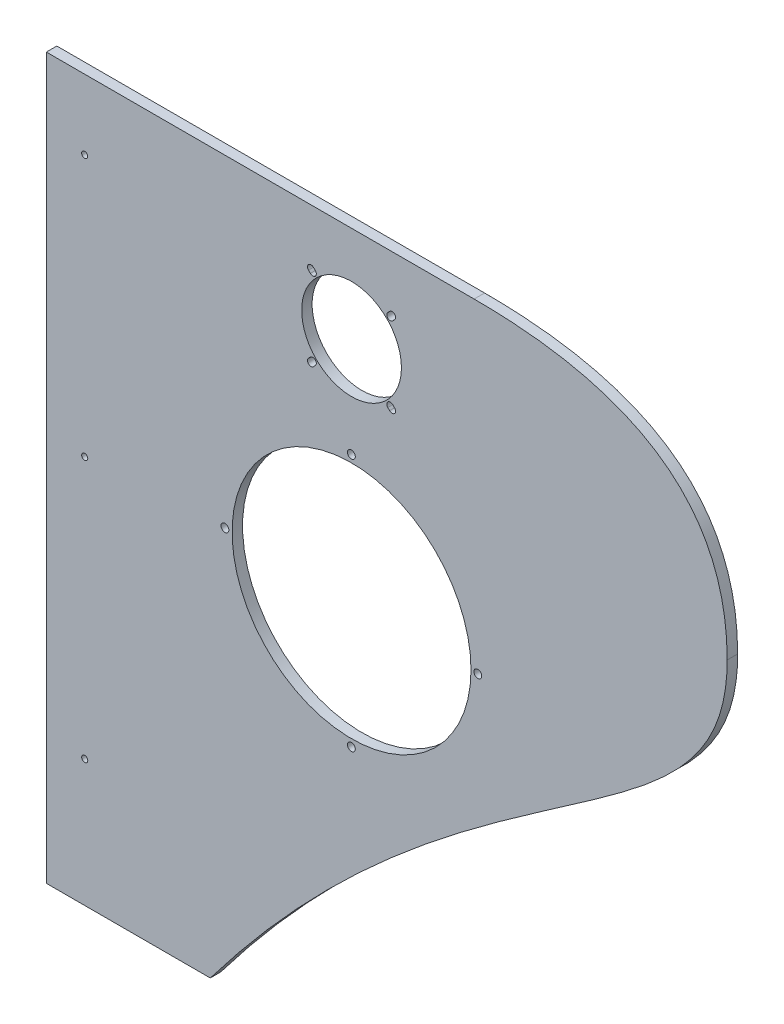
from build123d import *

# Parameters (mm, degrees)
BOSS_EXTRU_2_DEPTH      = 6
ENL_V_MAT_EXTRU_4_REACH = 384.756
ESQUISSE3_R             = 28.6
ESQUISSE3_R_2           = 2.25
ESQUISSE3_R_3           = 68.5
ESQUISSE3_R_4           = 1.75


# Read off the part's stored shape, not the designer's step: Boss.-Extru.2
with BuildPart() as part:
    # Boss.-Extru.2 outline → Boss.-Extru.2 (new body)
    with BuildSketch(Plane.XY):
        with BuildLine():
            Line((-245.29717671, -293.760797952), (-151.297176712, -293.760797952))
            add(Edge.make_bspline(
                [(-151.297176712, -293.760797952), (-0.19831868, -94.220513637), (145.094881688, -93.952973746), (145.094881688, 83.475896448), (96.728584845, 119.040016289), (-0.00400884, 119.040016289)],
                knots=[0, 0, 0, 0, 1, 1, 1.669123403, 1.669123403, 1.669123403, 1.669123403], degree=3))
            Line((-0.00400884, 119.040016289), (-245.29717671, 119.040016289))
            Line((-245.29717671, 119.040016289), (-245.29717671, -293.760797952))
        make_face()
    extrude(amount=BOSS_EXTRU_2_DEPTH)

    # Esquisse3 → Enlèv. mat.-Extru.4 (cut, up to next)
    with BuildSketch(Plane.XY.offset(6), mode=Mode.PRIVATE) as enl_v_mat_extru_4_sk1:
        with BuildLine():
            ThreePointArc((-45.626220991, 85.882544634), (-45.626220991, 88.710971759), (-48.454648116, 88.710971759))
            Line((-48.454648116, 88.710971759), (-49.515308288, 87.650311587))
            ThreePointArc((-49.515308288, 87.650311587), (-49.515308288, 84.821884462), (-46.686881163, 84.821884462))
            Line((-46.686881163, 84.821884462), (-45.626220991, 85.882544634))
        make_face()
    enl_v_mat_extru_4_tool1 = extrude(enl_v_mat_extru_4_sk1.sketch, amount=-ENL_V_MAT_EXTRU_4_REACH, mode=Mode.PRIVATE) & part.part
    # Esquisse3 → Enlèv. mat.-Extru.4 (cut, up to next)
    with BuildSketch(Plane.XY.offset(6), mode=Mode.PRIVATE) as enl_v_mat_extru_4_sk2:
        with BuildLine():
            ThreePointArc((-48.454648366, 39.369060568), (-45.626221242, 39.369060568), (-45.626221242, 42.197487693))
            Line((-45.626221242, 42.197487693), (-46.686881414, 43.258147865))
            ThreePointArc((-46.686881414, 43.258147865), (-49.515308538, 43.258147865), (-49.515308538, 40.42972074))
            Line((-49.515308538, 40.42972074), (-48.454648366, 39.369060568))
        make_face()
    enl_v_mat_extru_4_tool2 = extrude(enl_v_mat_extru_4_sk2.sketch, amount=-ENL_V_MAT_EXTRU_4_REACH, mode=Mode.PRIVATE) & part.part
    # Esquisse3 → Enlèv. mat.-Extru.4 (cut, up to next)
    with BuildSketch(Plane.XY.offset(6), mode=Mode.PRIVATE) as enl_v_mat_extru_4_sk3:
        with BuildLine():
            ThreePointArc((-94.968132433, 42.197487943), (-94.968132433, 39.369060819), (-92.139705308, 39.369060819))
            Line((-92.139705308, 39.369060819), (-91.079045136, 40.42972099))
            ThreePointArc((-91.079045136, 40.42972099), (-91.079045136, 43.258148115), (-93.907472261, 43.258148115))
            Line((-93.907472261, 43.258148115), (-94.968132433, 42.197487943))
        make_face()
    enl_v_mat_extru_4_tool3 = extrude(enl_v_mat_extru_4_sk3.sketch, amount=-ENL_V_MAT_EXTRU_4_REACH, mode=Mode.PRIVATE) & part.part
    # Esquisse3 → Enlèv. mat.-Extru.4 (cut, up to next)
    with BuildSketch(Plane.XY.offset(6), mode=Mode.PRIVATE) as enl_v_mat_extru_4_sk4:
        with BuildLine():
            ThreePointArc((-92.139705057, 88.710972009), (-94.968132182, 88.710972009), (-94.968132182, 85.882544885))
            Line((-94.968132182, 85.882544885), (-93.90747201, 84.821884713))
            ThreePointArc((-93.90747201, 84.821884713), (-91.079044886, 84.821884713), (-91.079044886, 87.650311838))
            Line((-91.079044886, 87.650311838), (-92.139705057, 88.710972009))
        make_face()
    enl_v_mat_extru_4_tool4 = extrude(enl_v_mat_extru_4_sk4.sketch, amount=-ENL_V_MAT_EXTRU_4_REACH, mode=Mode.PRIVATE) & part.part
    # Esquisse3 → Enlèv. mat.-Extru.4 (cut, up to next)
    with BuildSketch(Plane.XY.offset(6), mode=Mode.PRIVATE) as enl_v_mat_extru_4_sk5:
        with Locations((-70.29717671, 64.040016289)):
            Circle(ESQUISSE3_R)
    enl_v_mat_extru_4_tool5 = extrude(enl_v_mat_extru_4_sk5.sketch, amount=-ENL_V_MAT_EXTRU_4_REACH, mode=Mode.PRIVATE) & part.part
    # Esquisse3 → Enlèv. mat.-Extru.4 (cut, up to next)
    with BuildSketch(Plane.XY.offset(6), mode=Mode.PRIVATE) as enl_v_mat_extru_4_sk6:
        with Locations((-70.403386226, 6.6461892)):
            Circle(ESQUISSE3_R_2)
    enl_v_mat_extru_4_tool6 = extrude(enl_v_mat_extru_4_sk6.sketch, amount=-ENL_V_MAT_EXTRU_4_REACH, mode=Mode.PRIVATE) & part.part
    # Esquisse3 → Enlèv. mat.-Extru.4 (cut, up to next)
    with BuildSketch(Plane.XY.offset(6), mode=Mode.PRIVATE) as enl_v_mat_extru_4_sk7:
        with Locations((2.096613774, -66.037218513)):
            Circle(ESQUISSE3_R_2)
    enl_v_mat_extru_4_tool7 = extrude(enl_v_mat_extru_4_sk7.sketch, amount=-ENL_V_MAT_EXTRU_4_REACH, mode=Mode.PRIVATE) & part.part
    # Esquisse3 → Enlèv. mat.-Extru.4 (cut, up to next)
    with BuildSketch(Plane.XY.offset(6), mode=Mode.PRIVATE) as enl_v_mat_extru_4_sk8:
        with Locations((-70.403386226, -138.537218513)):
            Circle(ESQUISSE3_R_2)
    enl_v_mat_extru_4_tool8 = extrude(enl_v_mat_extru_4_sk8.sketch, amount=-ENL_V_MAT_EXTRU_4_REACH, mode=Mode.PRIVATE) & part.part
    # Esquisse3 → Enlèv. mat.-Extru.4 (cut, up to next)
    with BuildSketch(Plane.XY.offset(6), mode=Mode.PRIVATE) as enl_v_mat_extru_4_sk9:
        with Locations((-142.903386226, -66.037218513)):
            Circle(ESQUISSE3_R_2)
    enl_v_mat_extru_4_tool9 = extrude(enl_v_mat_extru_4_sk9.sketch, amount=-ENL_V_MAT_EXTRU_4_REACH, mode=Mode.PRIVATE) & part.part
    # Esquisse3 → Enlèv. mat.-Extru.4 (cut, up to next)
    with BuildSketch(Plane.XY.offset(6), mode=Mode.PRIVATE) as enl_v_mat_extru_4_sk10:
        with Locations((-70.29717671, -65.959983711)):
            Circle(ESQUISSE3_R_3)
    enl_v_mat_extru_4_tool10 = extrude(enl_v_mat_extru_4_sk10.sketch, amount=-ENL_V_MAT_EXTRU_4_REACH, mode=Mode.PRIVATE) & part.part
    # Esquisse3 → Enlèv. mat.-Extru.4 (cut, up to next)
    with BuildSketch(Plane.XY.offset(6), mode=Mode.PRIVATE) as enl_v_mat_extru_4_sk11:
        with Locations((-223.29717671, 79.040016289)):
            Circle(ESQUISSE3_R_4)
    enl_v_mat_extru_4_tool11 = extrude(enl_v_mat_extru_4_sk11.sketch, amount=-ENL_V_MAT_EXTRU_4_REACH, mode=Mode.PRIVATE) & part.part
    # Esquisse3 → Enlèv. mat.-Extru.4 (cut, up to next)
    with BuildSketch(Plane.XY.offset(6), mode=Mode.PRIVATE) as enl_v_mat_extru_4_sk12:
        with Locations((-223.29717671, -70.959983711)):
            Circle(ESQUISSE3_R_4)
    enl_v_mat_extru_4_tool12 = extrude(enl_v_mat_extru_4_sk12.sketch, amount=-ENL_V_MAT_EXTRU_4_REACH, mode=Mode.PRIVATE) & part.part
    # Esquisse3 → Enlèv. mat.-Extru.4 (cut, up to next)
    with BuildSketch(Plane.XY.offset(6), mode=Mode.PRIVATE) as enl_v_mat_extru_4_sk13:
        with Locations((-223.29717671, -220.959983711)):
            Circle(ESQUISSE3_R_4)
    enl_v_mat_extru_4_tool13 = extrude(enl_v_mat_extru_4_sk13.sketch, amount=-ENL_V_MAT_EXTRU_4_REACH, mode=Mode.PRIVATE) & part.part
    add(enl_v_mat_extru_4_tool1.solids().sort_by_distance((-47.570765, 86.766428, 6))[0], mode=Mode.SUBTRACT)
    add(enl_v_mat_extru_4_tool2.solids().sort_by_distance((-47.570765, 41.313604, 6))[0], mode=Mode.SUBTRACT)
    add(enl_v_mat_extru_4_tool3.solids().sort_by_distance((-93.023589, 41.313604, 6))[0], mode=Mode.SUBTRACT)
    add(enl_v_mat_extru_4_tool4.solids().sort_by_distance((-93.023589, 86.766428, 6))[0], mode=Mode.SUBTRACT)
    add(enl_v_mat_extru_4_tool5.solids().sort_by_distance((-70.297177, 64.040016, 6))[0], mode=Mode.SUBTRACT)
    add(enl_v_mat_extru_4_tool6.solids().sort_by_distance((-70.403386, 6.646189, 6))[0], mode=Mode.SUBTRACT)
    add(enl_v_mat_extru_4_tool7.solids().sort_by_distance((2.096614, -66.037219, 6))[0], mode=Mode.SUBTRACT)
    add(enl_v_mat_extru_4_tool8.solids().sort_by_distance((-70.403386, -138.537219, 6))[0], mode=Mode.SUBTRACT)
    add(enl_v_mat_extru_4_tool9.solids().sort_by_distance((-142.903386, -66.037219, 6))[0], mode=Mode.SUBTRACT)
    add(enl_v_mat_extru_4_tool10.solids().sort_by_distance((-70.297177, -65.959984, 6))[0], mode=Mode.SUBTRACT)
    add(enl_v_mat_extru_4_tool11.solids().sort_by_distance((-223.297177, 79.040016, 6))[0], mode=Mode.SUBTRACT)
    add(enl_v_mat_extru_4_tool12.solids().sort_by_distance((-223.297177, -70.959984, 6))[0], mode=Mode.SUBTRACT)
    add(enl_v_mat_extru_4_tool13.solids().sort_by_distance((-223.297177, -220.959984, 6))[0], mode=Mode.SUBTRACT)


solid = part.part
